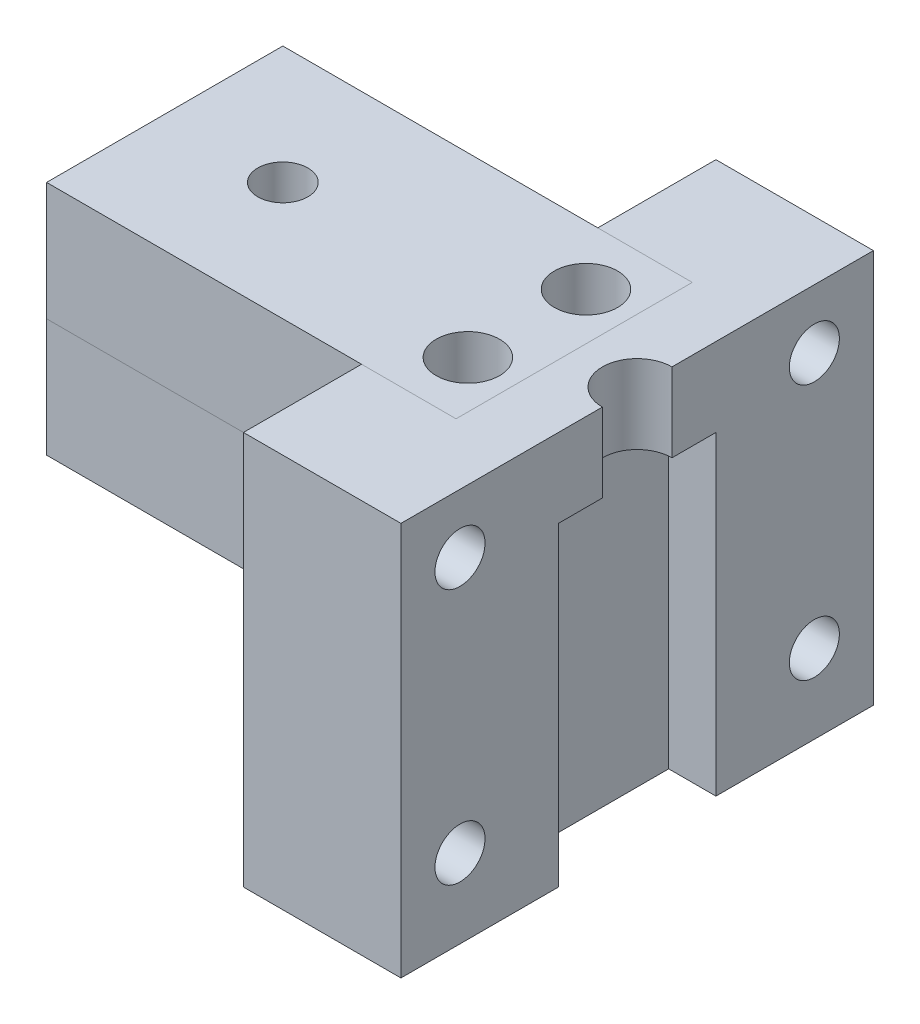
from build123d import *

# Parameters (mm, degrees)
SKETCH2_W                          = 12.7
SKETCH2_H                          = 38.1
BOSS_EXTRUDE1_DEPTH                = 31.75
SKETCH8_W                          = 3.81
SKETCH8_H                          = 12.7
CUT_EXTRUDE2_DEPTH                 = 25.4
F_10_CLEARANCE_HOLE2_D             = 5.6134
F_10_32_TAPPED_HOLE1_D             = 4.0386
SKETCH11_W                         = 19.05
SKETCH11_H                         = 9.525
CUT_EXTRUDE3_DEPTH                 = 7.62
F_10_32_TAPPED_HOLE4_D             = 4.0386
F_10_32_TAPPED_HOLE4_DEPTH         = 12.7
F_10_32_TAPPED_HOLE4_TIP           = 1.213317848
BOSS_EXTRUDE4_REACH                = 55.128
SKETCH15_W                         = 2.0193
SKETCH15_H                         = 31.75
F_10_START                         = -19.05
F_10_CLEARANCE_HOLE4_OUTLINE_R     = 2.0193
F_10_CLEARANCE_HOLE4_DEPTH         = 19.05
F_10_START_2                       = -9.525
F_10_CLEARANCE_HOLE4_2_OUTLINE_R   = 2.5527
F_10_CLEARANCE_HOLE4_2_OUTLINE_R_2 = 2.0193
F_10_CLEARANCE_HOLE4_2_DEPTH       = 9.525


# Read off the part's stored shape, not the designer's step: #10 Clearance Hole4
with BuildPart() as part:
    # Sketch2 → Boss-Extrude1 (new body)
    with BuildSketch(Plane(origin=(0, 0, 0), x_dir=(1, 0, 0), z_dir=(0, 1, 0))):
        with Locations((-6.35, 0)):
            Rectangle(SKETCH2_W, SKETCH2_H)
    extrude(amount=-BOSS_EXTRUDE1_DEPTH)

    # Sketch8 → Cut-Extrude2 (cut)
    with BuildSketch(Plane.XZ.offset(31.75)):
        with Locations((-1.905, 0)):
            Rectangle(SKETCH8_W, SKETCH8_H)
    extrude(amount=-CUT_EXTRUDE2_DEPTH, mode=Mode.SUBTRACT)

    # #10 Clearance Hole2 (through all)
    with Locations(Plane(origin=(0, 0, 0), x_dir=(1, 0, 0), z_dir=(0, 1, 0))):
        with Locations((0, 0)):
            Hole(F_10_CLEARANCE_HOLE2_D / 2)

    # #10-32 Tapped Hole1 (through all)
    with Locations(Plane.ZY.offset(12.7)):
        with Locations((14.2875, -4.7625), (14.2875, -25.4), (-14.2875, -25.4), (-14.2875, -4.7625)):
            Hole(F_10_32_TAPPED_HOLE1_D / 2)

    # Sketch11 → Cut-Extrude3 (cut)
    with BuildSketch(Plane.ZY.offset(12.7)):
        with Locations((0, -4.7625)):
            Rectangle(SKETCH11_W, SKETCH11_H)
    extrude(amount=-CUT_EXTRUDE3_DEPTH, mode=Mode.SUBTRACT)

    # #10-32 Tapped Hole4
    with Locations(Plane(origin=(0, -9.525, 0), x_dir=(1, 0, 0), z_dir=(0, 1, 0))):
        with Locations((-8.89, 4.7625), (-8.89, -4.7625)):
            Hole(F_10_32_TAPPED_HOLE4_D / 2, depth=F_10_32_TAPPED_HOLE4_DEPTH)
            with Locations((0, 0, -(F_10_32_TAPPED_HOLE4_DEPTH + F_10_32_TAPPED_HOLE4_TIP / 2))):  # 118° drill point
                Cone(0, F_10_32_TAPPED_HOLE4_D / 2, F_10_32_TAPPED_HOLE4_TIP, mode=Mode.SUBTRACT)


with BuildPart() as body_2:

    # Sketch20 → Boss-Extrude4 (new, up to next)
    with BuildSketch(Plane.ZY.offset(38.1), mode=Mode.PRIVATE) as boss_extrude4_sk1:
        Polygon((-9.525, -9.525), (-9.525, -19.05), (9.525, -19.05), (9.525, -9.525), (9.525, 0), (-9.525, 0), align=None)
    boss_extrude4_tool1 = extrude(boss_extrude4_sk1.sketch, amount=-BOSS_EXTRUDE4_REACH, mode=Mode.PRIVATE) - part.part
    add(boss_extrude4_tool1.solids().sort_by_distance((-38.1, -9.525, 0))[0])

    # Sketch15 → #10-32 Tapped Hole2 (revolve, cut)
    with BuildSketch(Plane(origin=(-28.575, 0, 0), x_dir=(0, 0, 1), z_dir=(1, 0, 0))):
        with Locations((1.00965, 15.875)):
            Rectangle(SKETCH15_W, SKETCH15_H)
    revolve(axis=Axis((-28.575, 6.35, 0), (0, -1, 0)), mode=Mode.SUBTRACT)

    # #10 Clearance Hole4 outline → #10 Clearance Hole4 (cut)
    with BuildSketch(Plane(origin=(0, 0, 0), x_dir=(1, 0, 0), z_dir=(0, 1, 0)).offset(F_10_START)):
        with Locations((-8.89, 4.7625)):
            Circle(F_10_CLEARANCE_HOLE4_OUTLINE_R)
        with Locations((-8.89, -4.7625)):
            Circle(F_10_CLEARANCE_HOLE4_OUTLINE_R)
    extrude(amount=F_10_CLEARANCE_HOLE4_DEPTH, mode=Mode.SUBTRACT)

    # 10 Clearance Hole4 2 outline → 10 Clearance Hole4 2 (cut)
    # profile 1 of 2: a face of its own
    with BuildSketch(Plane(origin=(0, 0, 0), x_dir=(1, 0, 0), z_dir=(0, 1, 0)).offset(F_10_START_2)):
        with Locations((-8.89, 4.7625)):
            Circle(F_10_CLEARANCE_HOLE4_2_OUTLINE_R)
        with Locations((-8.89, 4.7625)):
            Circle(F_10_CLEARANCE_HOLE4_2_OUTLINE_R_2, mode=Mode.SUBTRACT)
    # profile 2 of 2: a face of its own
    with BuildSketch(Plane(origin=(0, 0, 0), x_dir=(1, 0, 0), z_dir=(0, 1, 0)).offset(F_10_START_2)):
        with Locations((-8.89, -4.7625)):
            Circle(F_10_CLEARANCE_HOLE4_2_OUTLINE_R)
        with Locations((-8.89, -4.7625)):
            Circle(F_10_CLEARANCE_HOLE4_2_OUTLINE_R_2, mode=Mode.SUBTRACT)
    extrude(amount=F_10_CLEARANCE_HOLE4_2_DEPTH, mode=Mode.SUBTRACT)


solid = Compound([part.part, body_2.part])
